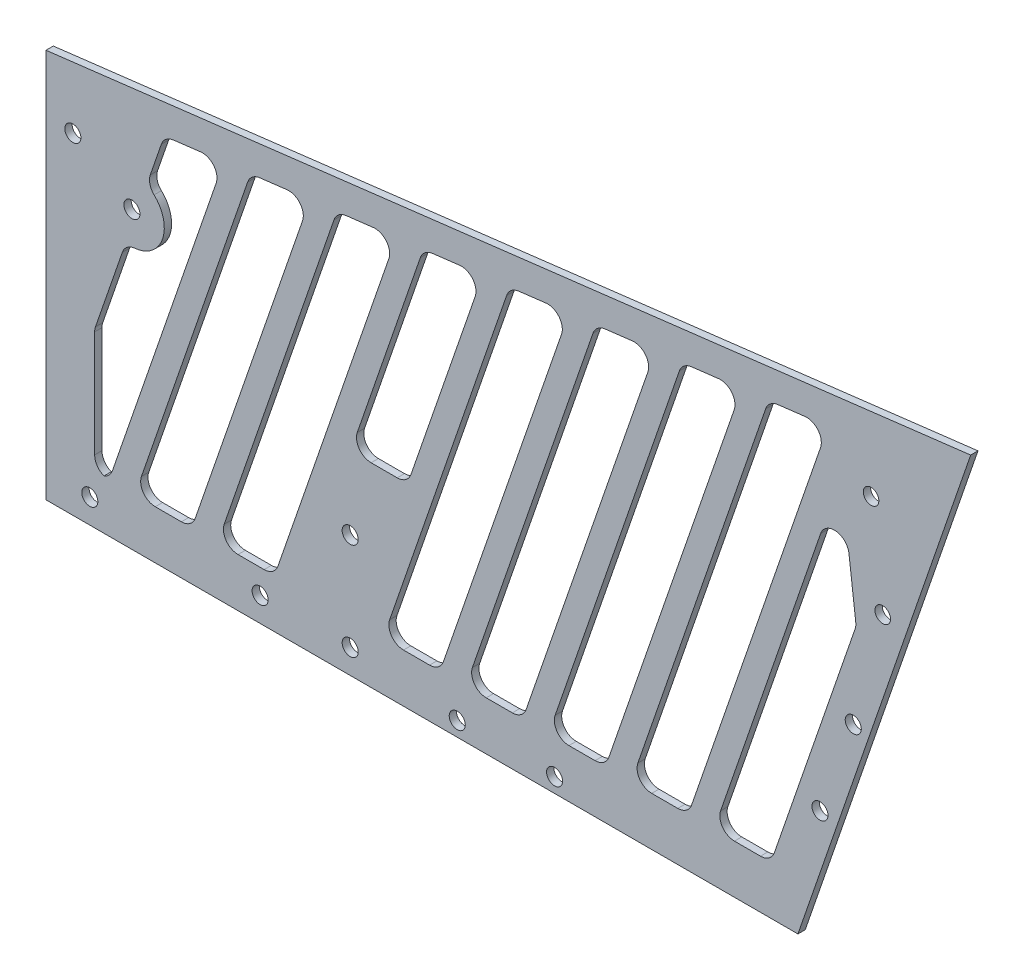
from build123d import *

# Parameters (mm, degrees)
SKETCH_1_R          = 1.65
EXTRUDE_1_DEPTH     = 1.5
SKETCH_2_R          = 1.65
CUT_EXTRUDE_1_DEPTH = 217.113258134
SKETCH_5_R          = 1.6
CUT_EXTRUDE_3_DEPTH = 217.113258134
CUT_EXTRUDE_4_DEPTH = 10
FILLET_3_R          = 3
FILLET_4_R          = 5
SKETCH_7_W          = 17
SKETCH_7_H          = 10
EXTRUDE_2_DEPTH     = 1.5
FILLET_5_R          = 3


with BuildPart() as part:
    # 草图1 → 凸台-拉伸1 (new body)
    with BuildSketch(Plane.XY):
        Polygon((0, 0), (49, 0), (154.500036, 0), (190, 102.969366032), (0, 80), align=None)
        with Locations((44, 5)):
            Circle(SKETCH_1_R, mode=Mode.SUBTRACT)
        with Locations((9, 5)):
            Circle(SKETCH_1_R, mode=Mode.SUBTRACT)
        with Locations((62.500036, 5)):
            Circle(SKETCH_1_R, mode=Mode.SUBTRACT)
        with Locations((62.500036, 25)):
            Circle(SKETCH_1_R, mode=Mode.SUBTRACT)
        with Locations((84.500036, 3)):
            Circle(SKETCH_1_R, mode=Mode.SUBTRACT)
        with Locations((104.500036, 3)):
            Circle(SKETCH_1_R, mode=Mode.SUBTRACT)
        with Locations((159.029214579, 24.172402674)):
            Circle(SKETCH_1_R, mode=Mode.SUBTRACT)
        with Locations((165.869617446, 42.96625509)):
            Circle(SKETCH_1_R, mode=Mode.SUBTRACT)
        with Locations((5.51669804, 68)):
            Circle(SKETCH_1_R, mode=Mode.SUBTRACT)
    extrude(amount=EXTRUDE_1_DEPTH)

    # 草图2 → 切除-拉伸1 (cut, through all)
    with BuildSketch(Plane(origin=(0, 0, 0), x_dir=(-1, 0, 0), z_dir=(0, 0, -1))):
        with Locations((-17.654838092, 60.522562577)):
            Circle(SKETCH_2_R)
    extrude(amount=-CUT_EXTRUDE_1_DEPTH, mode=Mode.SUBTRACT)

    # 草图5 → 切除-拉伸3 (cut, through all)
    with BuildSketch(Plane.XY.offset(1.5)):
        with Locations((169.526207601, 85.385047705)):
            Circle(SKETCH_5_R)
        with Locations((171.926558982, 65.529612347)):
            Circle(SKETCH_5_R)
    extrude(amount=-CUT_EXTRUDE_3_DEPTH, mode=Mode.SUBTRACT)

    # 草图6 → 切除-拉伸4 (cut)
    with BuildSketch(Plane(origin=(0, 0, 0), x_dir=(-1, 0, 0), z_dir=(0, 0, -1))):
        Polygon((-166.458788313, 60.765712768), (-148.956680209, 10), (-137.24549175, 10), (-163.418370686, 85.91570378), align=None)
        Polygon((-160.704378524, 93.384092174), (-131.956680209, 10), (-120.24549175, 10), (-148.483853144, 91.90673575), align=None)
        Polygon((-142.96502336, 91.23955669), (-114.956680209, 10), (-103.24549175, 10), (-130.74449798, 89.762200266), align=None)
        Polygon((-125.225668197, 89.095021206), (-97.956680209, 10), (-86.24549175, 10), (-113.005142817, 87.617664782), align=None)
        Polygon((-107.486313033, 86.950485723), (-80.956680209, 10), (-69.24549175, 10), (-95.265787653, 85.473129299), align=None)
        with BuildLine():
            Line((-77.526432489, 83.328593815), (-89.746957869, 84.805950239))
            Line((-89.746957869, 84.805950239), (-69.149740199, 25.062722173))
            ThreePointArc((-69.149740199, 25.062722173), (-65.935444688, 30.69389736), (-59.455145067, 30.91194885))
            Line((-59.455145067, 30.91194885), (-77.526432489, 83.328593815))
        make_face()
        with BuildLine():
            Line((-12.956680209, 10), (-10, 10))
            Line((-10, 10), (-10, 35.392875452))
            Line((-10, 35.392875452), (-16.411528112, 53.989823466))
            ThreePointArc((-16.411528112, 53.989823466), (-23.94169474, 58.355090898), (-20.701647581, 66.4335229))
            Line((-20.701647581, 66.4335229), (-24.308366998, 76.894987363))
            Line((-24.308366998, 76.894987363), (-36.528892378, 78.372343787))
            Line((-36.528892378, 78.372343787), (-12.956680209, 10))
        make_face()
        Polygon((-72.007602706, 82.661414755), (-46.956680209, 10), (-35.24549175, 10), (-59.787077326, 81.184058331), align=None)
        Polygon((-29.956680209, 10), (-18.24549175, 10), (-42.047722162, 79.039522847), (-54.268247542, 80.516879271), align=None)
    extrude(amount=-CUT_EXTRUDE_4_DEPTH, mode=Mode.SUBTRACT)

    # 圆角3
    # the kernel refuses this fillet: 3 mm, written as the material it adds along each edge
    with BuildSketch(Plane(origin=(89.746957869, 84.805950239, 0), x_dir=(-0.32593559085415924, -0.9453919772319576, 0), z_dir=(0, 0, 1)), Plane(origin=(107.486313033, 86.950485723, 0), x_dir=(-0.32593559085416013, -0.9453919772319572, 0), z_dir=(0, 0, 1)), Plane(origin=(54.268247542, 80.516879271, 0), x_dir=(-0.32593559085415885, -0.9453919772319577, 0), z_dir=(0, 0, 1)), Plane(origin=(125.225668197, 89.095021206, 0), x_dir=(-0.32593559085416013, -0.9453919772319572, 0), z_dir=(0, 0, 1)), Plane(origin=(142.96502336, 91.23955669, 0), x_dir=(-0.3259355908541637, -0.945391977231956, 0), z_dir=(0, 0, 1)), Plane(origin=(36.528892378, 78.372343787, 0), x_dir=(-0.32593559085416013, -0.9453919772319572, 0), z_dir=(0, 0, 1))) as fillet_3_piece_1:
        with BuildLine():
            CenterArc((FILLET_3_R * 1.59770807733, -FILLET_3_R), FILLET_3_R, 90, 115.915383649)
            Line((FILLET_3_R * 0.698267610033, -FILLET_3_R * 1.43704329967), (0, 0))
            Line((0, 0), (FILLET_3_R * 1.59770807733, 0))
        make_face()
    extrude(amount=1.5)
    with BuildSketch(Plane(origin=(77.526432489, 83.328593815, 0), x_dir=(-0.32593559085416024, -0.9453919772319572, 0), z_dir=(0, 0, 1))) as fillet_3_piece_2:
        with BuildLine():
            CenterArc((FILLET_3_R * 0.625896566582, FILLET_3_R), FILLET_3_R, 205.915383649, 64.084616351)
            Line((-FILLET_3_R * 0.273543900714, FILLET_3_R * 0.562956700325), (0, 0))
            Line((0, 0), (FILLET_3_R * 0.625896566582, 0))
        make_face()
    extrude(amount=1.5)
    with BuildSketch(Plane(origin=(95.265787653, 85.473129299, 0), x_dir=(0.9927717678876198, 0.12001756906924078, 0), z_dir=(0, 0, 1)), Plane(origin=(42.047722162, 79.039522847, 0), x_dir=(0.9927717678876197, 0.12001756906924214, 0), z_dir=(0, 0, 1)), Plane(origin=(59.787077326, 81.184058331, 0), x_dir=(0.9927717678876204, 0.12001756906923514, 0), z_dir=(0, 0, 1)), Plane(origin=(148.483853144, 91.90673575, 0), x_dir=(0.9927717678876198, 0.12001756906924078, 0), z_dir=(0, 0, 1)), Plane(origin=(113.005142817, 87.617664782, 0), x_dir=(0.9927717678876197, 0.12001756906924169, 0), z_dir=(0, 0, 1)), Plane(origin=(130.74449798, 89.762200266, 0), x_dir=(0.9927717678876193, 0.1200175690692444, 0), z_dir=(0, 0, 1)), Plane(origin=(24.308366998, 76.894987363, 0), x_dir=(0.9927717678876197, 0.12001756906924214, 0), z_dir=(0, 0, 1))) as fillet_3_piece_3:
        with BuildLine():
            CenterArc((FILLET_3_R * 0.625896566582, -FILLET_3_R), FILLET_3_R, 90, 64.084616351)
            Line((-FILLET_3_R * 0.273543900714, -FILLET_3_R * 0.562956700325), (0, 0))
            Line((0, 0), (FILLET_3_R * 0.625896566582, 0))
        make_face()
    extrude(amount=1.5)
    with BuildSketch(Plane(origin=(69.24549175, 10, 0), x_dir=(0.3259355908541607, 0.9453919772319569, 0), z_dir=(0, 0, 1)), Plane(origin=(35.24549175, 10, 0), x_dir=(0.3259355908541611, 0.9453919772319569, 0), z_dir=(0, 0, 1)), Plane(origin=(120.24549175, 10, 0), x_dir=(0.3259355908541582, 0.9453919772319579, 0), z_dir=(0, 0, 1)), Plane(origin=(137.24549175, 10, 0), x_dir=(0.3259355908541602, 0.9453919772319572, 0), z_dir=(0, 0, 1)), Plane(origin=(86.24549175, 10, 0), x_dir=(0.3259355908541607, 0.9453919772319569, 0), z_dir=(0, 0, 1)), Plane(origin=(103.24549175, 10, 0), x_dir=(0.3259355908541607, 0.9453919772319569, 0), z_dir=(0, 0, 1))) as fillet_3_piece_4:
        with BuildLine():
            CenterArc((FILLET_3_R * 1.40252469112, -FILLET_3_R), FILLET_3_R, 90, 109.022267108)
            Line((FILLET_3_R * 0.457132713888, -FILLET_3_R * 1.32593559085), (0, 0))
            Line((0, 0), (FILLET_3_R * 1.40252469112, 0))
        make_face()
    extrude(amount=1.5)
    with BuildSketch(Plane(origin=(80.956680209, 10, 0), x_dir=(0.32593559085415746, 0.9453919772319582, 0), z_dir=(0, 0, 1)), Plane(origin=(97.956680209, 10, 0), x_dir=(0.32593559085415946, 0.9453919772319574, 0), z_dir=(0, 0, 1)), Plane(origin=(114.956680209, 10, 0), x_dir=(0.3259355908541564, 0.9453919772319586, 0), z_dir=(0, 0, 1)), Plane(origin=(12.956680209, 10, 0), x_dir=(0.3259355908541589, 0.9453919772319578, 0), z_dir=(0, 0, 1))) as fillet_3_piece_5:
        with BuildLine():
            CenterArc((FILLET_3_R * 0.7129999253, FILLET_3_R), FILLET_3_R, 199.022267108, 70.977732892)
            Line((-FILLET_3_R * 0.232392051932, FILLET_3_R * 0.674064409146), (0, 0))
            Line((0, 0), (FILLET_3_R * 0.7129999253, 0))
        make_face()
    extrude(amount=1.5)
    with BuildSketch(Plane(origin=(18.24549175, 10, 0), x_dir=(1, 0, 0), z_dir=(0, 0, 1))) as fillet_3_piece_6:
        with BuildLine():
            CenterArc((FILLET_3_R * 1.40252469112, FILLET_3_R), FILLET_3_R, 160.977732892, 109.022267108)
            Line((FILLET_3_R * 0.457132713888, FILLET_3_R * 1.32593559085), (0, 0))
            Line((0, 0), (FILLET_3_R * 1.40252469112, 0))
        make_face()
    extrude(amount=1.5)
    with BuildSketch(Plane(origin=(29.956680209, 10, 0), x_dir=(-1, 0, 0), z_dir=(0, 0, 1)), Plane(origin=(46.956680209, 10, 0), x_dir=(-1, 0, 0), z_dir=(0, 0, 1)), Plane(origin=(131.956680209, 10, 0), x_dir=(-1, 0, 0), z_dir=(0, 0, 1)), Plane(origin=(148.956680209, 10, 0), x_dir=(-1, 0, 0), z_dir=(0, 0, 1))) as fillet_3_piece_7:
        with BuildLine():
            CenterArc((FILLET_3_R * 0.7129999253, -FILLET_3_R), FILLET_3_R, 90, 70.977732892)
            Line((-FILLET_3_R * 0.232392051932, -FILLET_3_R * 0.674064409146), (0, 0))
            Line((0, 0), (FILLET_3_R * 0.7129999253, 0))
        make_face()
    extrude(amount=1.5)
    with BuildSketch(Plane(origin=(72.007602706, 82.661414755, 0), x_dir=(-0.9927717678876198, -0.12001756906924071, 0), z_dir=(0, 0, 1)), Plane(origin=(160.704378524, 93.384092174, 0), x_dir=(-0.9927717678876197, -0.12001756906924108, 0), z_dir=(0, 0, 1))) as fillet_3_piece_8:
        with BuildLine():
            CenterArc((FILLET_3_R * 1.59770807733, FILLET_3_R), FILLET_3_R, 154.084616351, 115.915383649)
            Line((FILLET_3_R * 0.698267610033, FILLET_3_R * 1.43704329967), (0, 0))
            Line((0, 0), (FILLET_3_R * 1.59770807733, 0))
        make_face()
    extrude(amount=1.5)
    with BuildSketch(Plane(origin=(166.458788313, 60.765712768, 0), x_dir=(-0.3259355908541462, -0.9453919772319621, 0), z_dir=(0, 0, 1))) as fillet_3_piece_9:
        with BuildLine():
            CenterArc((FILLET_3_R * 0.230090548875, -FILLET_3_R), FILLET_3_R, 90, 25.915383649)
            Line((-FILLET_3_R * 0.2069527508, -FILLET_3_R * 0.100559532704), (0, 0))
            Line((0, 0), (FILLET_3_R * 0.230090548875, 0))
        make_face()
    extrude(amount=1.5)
    with BuildSketch(Plane(origin=(163.418370686, 85.91570378, 0), x_dir=(-0.3259355908541588, -0.9453919772319578, 0), z_dir=(0, 0, 1))) as fillet_3_piece_10:
        with BuildLine():
            CenterArc((FILLET_3_R * 4.34611506162, FILLET_3_R), FILLET_3_R, 115.915383649, 154.084616351)
            Line((FILLET_3_R * 3.90907176194, FILLET_3_R * 1.8994404673), (0, 0))
            Line((0, 0), (FILLET_3_R * 4.34611506162, 0))
        make_face()
    extrude(amount=1.5)
    with BuildSketch(Plane(origin=(20.701647581, 66.4335229, 0), x_dir=(0.3259355908541343, 0.9453919772319662, 0), z_dir=(0, 0, 1))) as fillet_3_piece_11:
        with BuildLine():
            CenterArc((2.221583802, -3), FILLET_3_R, 90, 65.812499939)
            ThreePointArc((-0.515044774, -1.770827906), (-0.195837699, -0.903354926), (0, 0))
            Line((0, 0), (2.221583802, 0))
        make_face()
    extrude(amount=1.5)
    with BuildSketch(Plane(origin=(16.411528112, 53.989823466, 0), x_dir=(0.9988016907645847, -0.04894060201720955, 0), z_dir=(0, 0, 1))) as fillet_3_piece_12:
        with BuildLine():
            CenterArc((2.260194582, -2.971019192), FILLET_3_R, 97.970443489, 65.812499939)
            Line((-0.620437185, -2.133188292), (0, 0))
            ThreePointArc((0, 0), (0.922103925, -0.064240792), (1.84420785, 0))
        make_face()
    extrude(amount=1.5)
    with BuildSketch(Plane(origin=(10, 35.392875452, 0), x_dir=(0.3259355908541632, 0.9453919772319561, 0), z_dir=(0, 0, 1))) as fillet_3_piece_13:
        with BuildLine():
            CenterArc((FILLET_3_R * 0.167542374323, -FILLET_3_R), FILLET_3_R, 90, 19.022267108)
            Line((-FILLET_3_R * 0.158393216531, -FILLET_3_R * 0.054608022768), (0, 0))
            Line((0, 0), (FILLET_3_R * 0.167542374323, 0))
        make_face()
    extrude(amount=1.5)
    with BuildSketch(Plane(origin=(10, 10, 0), x_dir=(0, 1, 0), z_dir=(0, 0, 1))) as fillet_3_piece_14:
        with BuildLine():
            CenterArc((FILLET_3_R, -FILLET_3_R), FILLET_3_R, 90, 90)
            Line((0, -FILLET_3_R), (0, 0))
            Line((0, 0), (FILLET_3_R, 0))
        make_face()
    extrude(amount=1.5)

    # 圆角4
    fillet_4_edges = [part.edges().sort_by_distance(p)[0] for p in [
        (69.149740199, 25.062722173, 0.75),
    ]]
    fillet(fillet_4_edges, radius=FILLET_4_R)

    # 草图7 → 凸台-拉伸2 (add)
    with BuildSketch(Plane.XY.offset(1.5)):
        with Locations((67.640739409, 35)):
            Rectangle(SKETCH_7_W, SKETCH_7_H)
    extrude(amount=-EXTRUDE_2_DEPTH)

    # 圆角5
    fillet_5_edges = [part.edges().sort_by_distance(p)[0] for p in [
        (62.588363238, 40, 0.75),
        (74.299551697, 40, 0.75),
    ]]
    fillet(fillet_5_edges, radius=FILLET_5_R)


solid = part.part
